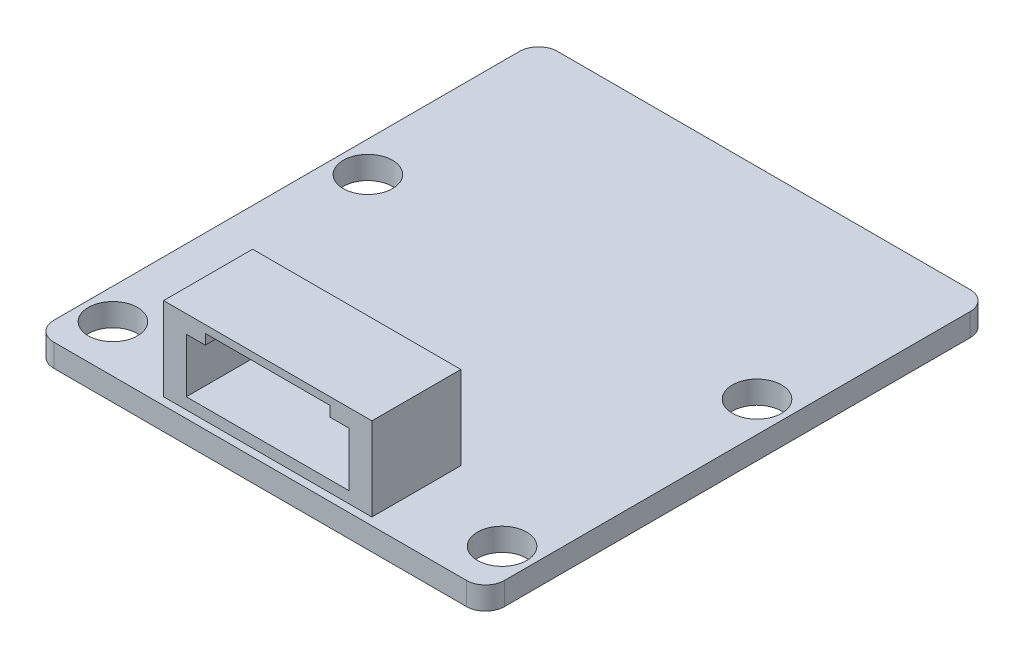
from build123d import *

# Parameters (mm, degrees)
SKETCH1_W            = 15.113
SKETCH1_H            = 33.782
BOSS_EXTRUDE1_DEPTH  = 1.524
FILLET1_R            = 1.27
SKETCH2_R            = 1.651
CUT_EXTRUDE1_DEPTH   = 23.716320697
SKETCH3_W            = 6.985
SKETCH3_H            = 5.969
BOSS_EXTRUDE2_DEPTH  = 5.588
CUT_EXTRUDE2_DEPTH   = 5.08
FILLET1_OF_MIRROR1_R = 1.27


with BuildPart() as part:
    # Sketch1 → Boss-Extrude1 (new body)
    with BuildSketch(Plane(origin=(0, 0, 0), x_dir=(1, 0, 0), z_dir=(0, 1, 0))):
        with Locations((-7.5565, 0)):
            Rectangle(SKETCH1_W, SKETCH1_H)
    boss_extrude1 = extrude(amount=BOSS_EXTRUDE1_DEPTH)

    # Fillet1
    fillet1_edges = [part.edges().sort_by_distance(p)[0] for p in [
        (-15.113, 0.762, -16.891),
        (-15.113, 0.762, 16.891),
    ]]
    fillet(fillet1_edges, radius=FILLET1_R)

    # Sketch2 → Cut-Extrude1 (cut, through all)
    with BuildSketch(Plane(origin=(0, 1.524, 0), x_dir=(1, 0, 0), z_dir=(0, 1, 0))):
        with Locations((-13.05052, -13.716)):
            Circle(SKETCH2_R)
        with Locations((-13.05052, 3.38328)):
            Circle(SKETCH2_R)
    cut_extrude1 = extrude(amount=-CUT_EXTRUDE1_DEPTH, mode=Mode.SUBTRACT)

    # Sketch3 → Boss-Extrude2 (add)
    with BuildSketch(Plane(origin=(0, 1.524, 0), x_dir=(1, 0, 0), z_dir=(0, 1, 0))):
        with Locations((-3.4925, -13.3985)):
            Rectangle(SKETCH3_W, SKETCH3_H)
    boss_extrude2 = extrude(amount=BOSS_EXTRUDE2_DEPTH)

    # Sketch4 → Cut-Extrude2 (cut)
    with BuildSketch(Plane.XY.offset(16.383)):
        Polygon((-4.191, 5.9182), (-5.461, 5.9182), (-5.461, 2.286), (0, 2.286), (0, 5.9182), (0, 6.604), (-4.191, 6.604), align=None)
    cut_extrude2 = extrude(amount=-CUT_EXTRUDE2_DEPTH, mode=Mode.SUBTRACT)

    # Mirror1: Boss-Extrude1, Cut-Extrude1, Boss-Extrude2, Cut-Extrude2 across plane
    add(boss_extrude1.mirror(Plane(origin=(0, 1.524, -16.891), x_dir=(0, 0, 1), z_dir=(-1, 0, 0))))
    add(cut_extrude1.mirror(Plane(origin=(0, 1.524, -16.891), x_dir=(0, 0, 1), z_dir=(-1, 0, 0))), mode=Mode.SUBTRACT)
    add(boss_extrude2.mirror(Plane(origin=(0, 1.524, -16.891), x_dir=(0, 0, 1), z_dir=(-1, 0, 0))))
    add(cut_extrude2.mirror(Plane(origin=(0, 1.524, -16.891), x_dir=(0, 0, 1), z_dir=(-1, 0, 0))), mode=Mode.SUBTRACT)

    # Fillet1 of Mirror1
    fillet1_of_mirror1_edges = [part.edges().sort_by_distance(p)[0] for p in [
        (15.113, 0.762, -16.891),
        (15.113, 0.762, 16.891),
    ]]
    fillet(fillet1_of_mirror1_edges, radius=FILLET1_OF_MIRROR1_R)


solid = part.part
